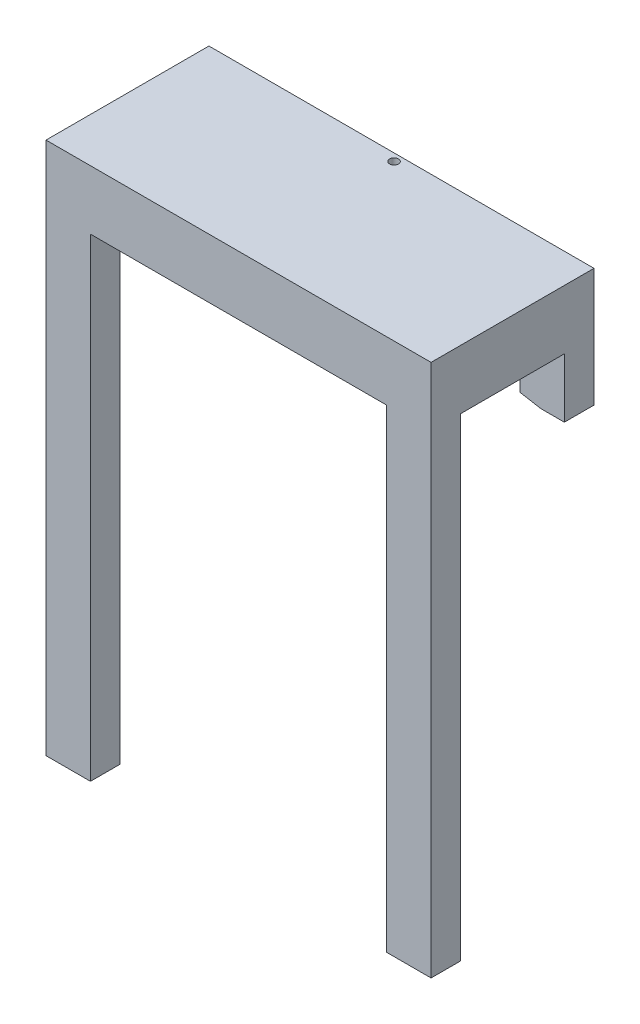
from build123d import *

# Parameters (mm, degrees)
SKETCH1_W           = 165.1
SKETCH1_H           = 228.6
BOSS_EXTRUDE1_DEPTH = 12.7
SKETCH2_W           = 127
SKETCH2_H           = 203.2
CUT_EXTRUDE1_DEPTH  = 142.563704741
SKETCH3_W           = 165.1
SKETCH3_H           = 25.4
BOSS_EXTRUDE2_DEPTH = 57.15
SKETCH4_W           = 19.05
SKETCH4_H           = 25.4
BOSS_EXTRUDE3_DEPTH = 12.7
CUT_EXTRUDE2_REACH  = 159.347
CUT_EXTRUDE3_REACH  = 251.677
SKETCH6_R           = 1.89865


with BuildPart() as part:
    # Sketch1 → Boss-Extrude1 (new body)
    with BuildSketch(Plane.XY):
        Rectangle(SKETCH1_W, SKETCH1_H)
    extrude(amount=BOSS_EXTRUDE1_DEPTH)

    # Sketch2 → Cut-Extrude1 (cut, through all)
    with BuildSketch(Plane.XY.offset(12.7)):
        with Locations((0, -12.7)):
            Rectangle(SKETCH2_W, SKETCH2_H)
    extrude(amount=-CUT_EXTRUDE1_DEPTH, mode=Mode.SUBTRACT)

    # Sketch3 → Boss-Extrude2 (add)
    with BuildSketch(Plane(origin=(0, 0, 0), x_dir=(-1, 0, 0), z_dir=(0, 0, -1))):
        with Locations((0, 101.6)):
            Rectangle(SKETCH3_W, SKETCH3_H)
    extrude(amount=BOSS_EXTRUDE2_DEPTH)

    # Sketch4 → Boss-Extrude3 (add)
    with BuildSketch(Plane(origin=(0, 0, -57.15), x_dir=(-1, 0, 0), z_dir=(0, 0, -1))):
        with Locations((-73.025, 76.2)):
            Rectangle(SKETCH4_W, SKETCH4_H)
    boss_extrude3 = extrude(amount=-BOSS_EXTRUDE3_DEPTH)

    # Mirror1: Boss-Extrude3 across plane
    add(boss_extrude3.mirror(Plane(origin=(0, 0, 0), x_dir=(0, 0, 1), z_dir=(1, 0, 0))))

    # Sketch5 → Cut-Extrude2 (cut, up to next)
    with BuildSketch(Plane(origin=(0, 0, -57.15), x_dir=(-1, 0, 0), z_dir=(0, 0, -1)), mode=Mode.PRIVATE) as cut_extrude2_sk1:
        Polygon((-72.503159889, 63.5), (-63.5, 65.0875), (-63.5, 63.5), align=None)
    cut_extrude2_tool1 = extrude(cut_extrude2_sk1.sketch, amount=-CUT_EXTRUDE2_REACH, mode=Mode.PRIVATE) & part.part
    cut_extrude2 = cut_extrude2_tool1.solids().sort_by_distance((66.501053, 64.029167, -57.15))[0]
    add(cut_extrude2, mode=Mode.SUBTRACT)

    # Mirror2: Cut-Extrude2 across plane
    add(cut_extrude2.mirror(Plane(origin=(0, 0, 0), x_dir=(0, 0, 1), z_dir=(1, 0, 0))), mode=Mode.SUBTRACT)

    # Sketch6 → Cut-Extrude3 (cut, up to next)
    with BuildSketch(Plane(origin=(0, 114.3, 0), x_dir=(1, 0, 0), z_dir=(0, 1, 0)), mode=Mode.PRIVATE) as cut_extrude3_sk1:
        with Locations((0, 53.975)):
            Circle(SKETCH6_R)
    cut_extrude3_tool1 = extrude(cut_extrude3_sk1.sketch, amount=-CUT_EXTRUDE3_REACH, mode=Mode.PRIVATE) & part.part
    add(cut_extrude3_tool1.solids().sort_by_distance((0, 114.3, -53.975))[0], mode=Mode.SUBTRACT)


solid = part.part
